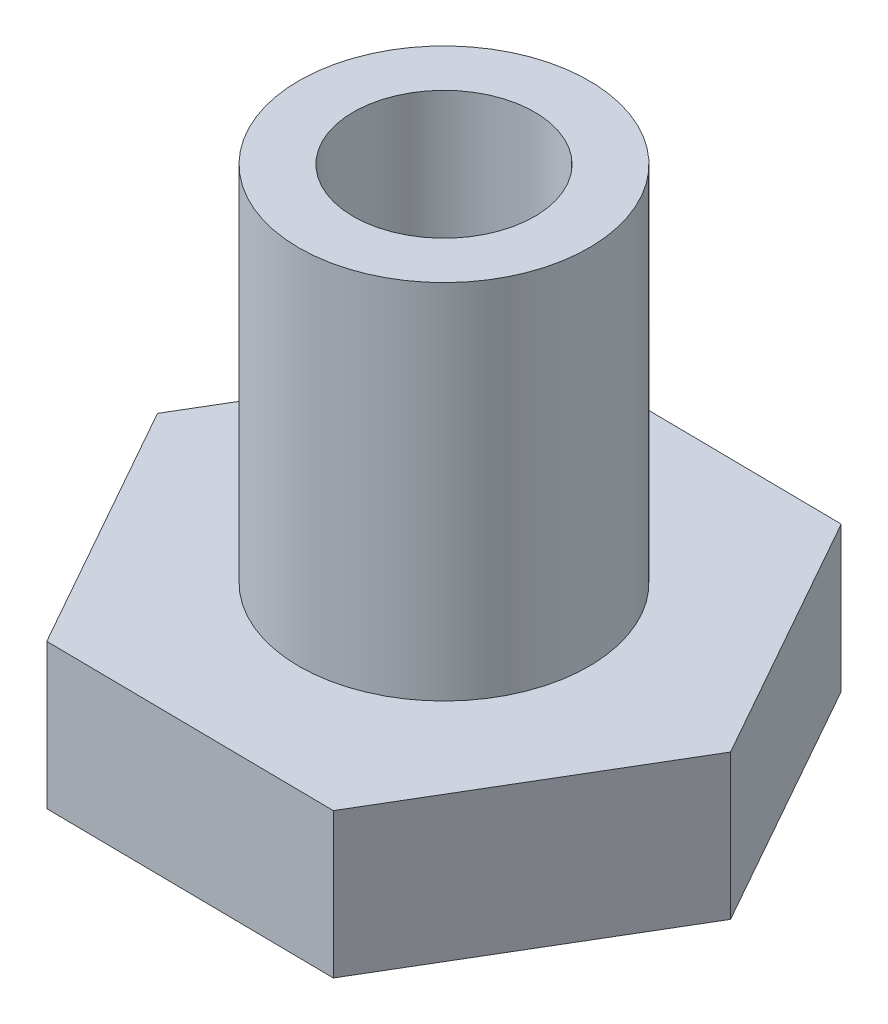
from build123d import *

# Parameters (mm, degrees)
BOSS_EXTRUDE1_DEPTH = 8
SKETCH2_R           = 8
BOSS_EXTRUDE2_DEPTH = 20
SKETCH6_R           = 5
CUT_EXTRUDE3_DEPTH  = 20


with BuildPart() as part:
    # Sketch1 → Boss-Extrude1 (new body)
    with BuildSketch(Plane(origin=(0, 0, 0), x_dir=(1, 0, 0), z_dir=(0, 1, 0))):
        Polygon((7.83950709, -13.949067085), (16, -0.185321249), (8.16049291, 13.763745836), (-7.83950709, 13.949067085), (-16, 0.185321249), (-8.16049291, -13.763745836), align=None)
    extrude(amount=BOSS_EXTRUDE1_DEPTH)

    # Sketch2 → Boss-Extrude2 (add)
    with BuildSketch(Plane(origin=(0, 8, 0), x_dir=(1, 0, 0), z_dir=(0, 1, 0))):
        Circle(SKETCH2_R)
    extrude(amount=BOSS_EXTRUDE2_DEPTH)

    # Sketch6 → Cut-Extrude3 (cut)
    with BuildSketch(Plane(origin=(0, 28, 0), x_dir=(1, 0, 0), z_dir=(0, 1, 0))):
        Circle(SKETCH6_R)
    extrude(amount=-CUT_EXTRUDE3_DEPTH, mode=Mode.SUBTRACT)


solid = part.part
